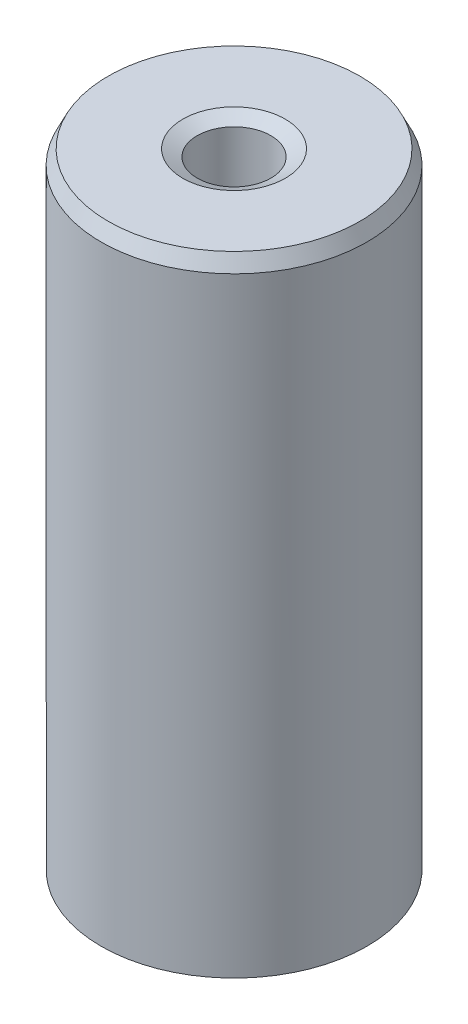
from build123d import *
from OCP.BRepFilletAPI import BRepFilletAPI_MakeChamfer

# Parameters (mm, degrees)
SKETCH1_R           = 5
BOSS_EXTRUDE1_DEPTH = 23.753005788
SKETCH2_R           = 1.386447656
CUT_EXTRUDE1_DEPTH  = 25.783165334
CHAMFER1_SIZE       = 0.542181434
CHAMFER1_SIZE2      = 0.266125638


with BuildPart() as part:
    # Sketch1 → Boss-Extrude1 (new body)
    with BuildSketch(Plane(origin=(0, 0, 0), x_dir=(1, 0, 0), z_dir=(0, 1, 0))):
        Circle(SKETCH1_R)
    extrude(amount=BOSS_EXTRUDE1_DEPTH)

    # Sketch2 → Cut-Extrude1 (cut, through all)
    with BuildSketch(Plane(origin=(0, 0, 0), x_dir=(1, 0, 0), z_dir=(0, 1, 0))):
        Circle(SKETCH2_R)
    extrude(amount=CUT_EXTRUDE1_DEPTH, mode=Mode.SUBTRACT)

    # Chamfer1: one chamfer whose edges measure the first distance from different faces: ONE call of the kernel's chamfer builder (chamfer() names one face for all edges)
    chamfer1_edges_1 = [part.edges().sort_by_distance(p)[0] for p in [
        (-1.386447656, 23.753005788, 0),
    ]]
    chamfer1_side_1 = [part.faces().sort_by_distance(p)[0] for p in [
        (-4.858578644, 23.753005788, 0),
    ]]
    chamfer1_edges_2 = [part.edges().sort_by_distance(p)[0] for p in [
        (-1.386447656, 0, 0),
    ]]
    chamfer1_side_2 = [part.faces().sort_by_distance(p)[0] for p in [
        (-1.386447656, 11.876502894, 0),
    ]]
    chamfer1_edges_3 = [part.edges().sort_by_distance(p)[0] for p in [
        (-5, 0, 0),
    ]]
    chamfer1_side_3 = [part.faces().sort_by_distance(p)[0] for p in [
        (-4.858578644, 0, 0),
    ]]
    chamfer1_edges_4 = [part.edges().sort_by_distance(p)[0] for p in [
        (-5, 23.753005788, 0),
    ]]
    chamfer1_side_4 = [part.faces().sort_by_distance(p)[0] for p in [
        (-5, 11.876502894, 0),
    ]]
    chamfer1 = BRepFilletAPI_MakeChamfer(part.part.solid().wrapped)
    for e in chamfer1_edges_1:
        chamfer1.Add(CHAMFER1_SIZE, CHAMFER1_SIZE2, e.wrapped, chamfer1_side_1[0].wrapped)  # the first distance lies on this face
    for e in chamfer1_edges_2:
        chamfer1.Add(CHAMFER1_SIZE, CHAMFER1_SIZE2, e.wrapped, chamfer1_side_2[0].wrapped)  # the first distance lies on this face
    for e in chamfer1_edges_3:
        chamfer1.Add(CHAMFER1_SIZE, CHAMFER1_SIZE2, e.wrapped, chamfer1_side_3[0].wrapped)  # the first distance lies on this face
    for e in chamfer1_edges_4:
        chamfer1.Add(CHAMFER1_SIZE, CHAMFER1_SIZE2, e.wrapped, chamfer1_side_4[0].wrapped)  # the first distance lies on this face
    add(Compound.cast(chamfer1.Shape()), mode=Mode.REPLACE)


solid = part.part
